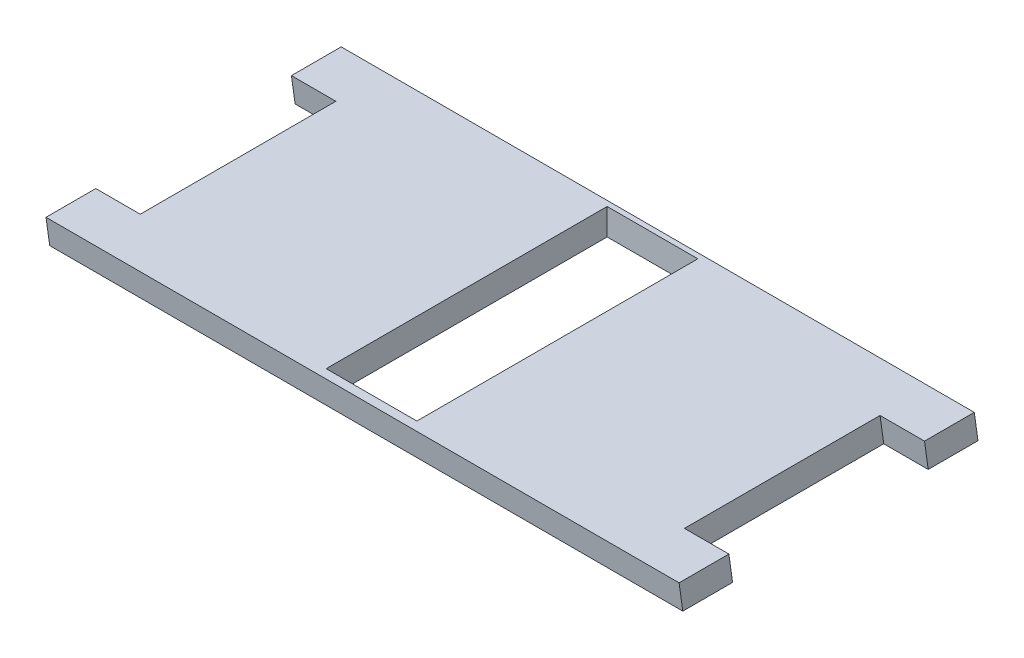
from build123d import *

# Parameters (mm, degrees)
SKETCH3_W          = 12.954
SKETCH3_H          = 40.132
CUT_EXTRUDE1_DEPTH = 12.7


with BuildPart() as part:
    # Sketch1 → Loft1 section 0
    with BuildSketch(Plane(origin=(0, 0, 0), x_dir=(1, 0, 0), z_dir=(0, 1, 0))):
        with BuildLine():
            Line((90.424, 0), (0, 0))
            Line((0, 0), (0, 7.112))
            Line((0, 7.112), (6.35, 7.112))
            Line((6.35, 7.112), (6.35, 35.052))
            Line((6.35, 35.052), (0, 35.052))
            Line((0, 35.052), (0, 42.164))
            Line((0, 42.164), (90.424, 42.164))
            Line((90.424, 42.164), (90.424, 35.052))
            Line((90.424, 35.052), (84.074, 35.052))
            Line((84.074, 35.052), (84.074, 7.112))
            Line((84.074, 7.112), (90.424, 7.112))
            Line((90.424, 7.112), (90.424, 0))
        make_face()
    # Sketch2 → Loft1 section 1
    with BuildSketch(Plane(origin=(0, 3.772916, 0), x_dir=(1, 0, 0), z_dir=(0, 1, 0))):
        with BuildLine():
            Line((0, -0.53024786), (90.424, -0.53024786))
            Line((90.424, -0.53024786), (90.424, 6.58175214))
            Line((90.424, 6.58175214), (84.074, 6.58175214))
            Line((84.074, 6.58175214), (84.074, 34.52175214))
            Line((84.074, 34.52175214), (90.424, 34.52175214))
            Line((90.424, 34.52175214), (90.424, 41.63375214))
            Line((90.424, 41.63375214), (0, 41.63375214))
            Line((0, 41.63375214), (0, 34.52175214))
            Line((0, 34.52175214), (6.35, 34.52175214))
            Line((6.35, 34.52175214), (6.35, 6.58175214))
            Line((6.35, 6.58175214), (0, 6.58175214))
            Line((0, 6.58175214), (0, -0.53024786))
        make_face()
    loft()

    # Sketch3 → Cut-Extrude1 (cut)
    with BuildSketch(Plane(origin=(0, 3.772916, 0), x_dir=(1, 0, 0), z_dir=(0, 1, 0))):
        with Locations((45.212, 20.81687607)):
            Rectangle(SKETCH3_W, SKETCH3_H)
    extrude(amount=-CUT_EXTRUDE1_DEPTH, mode=Mode.SUBTRACT)


solid = part.part
